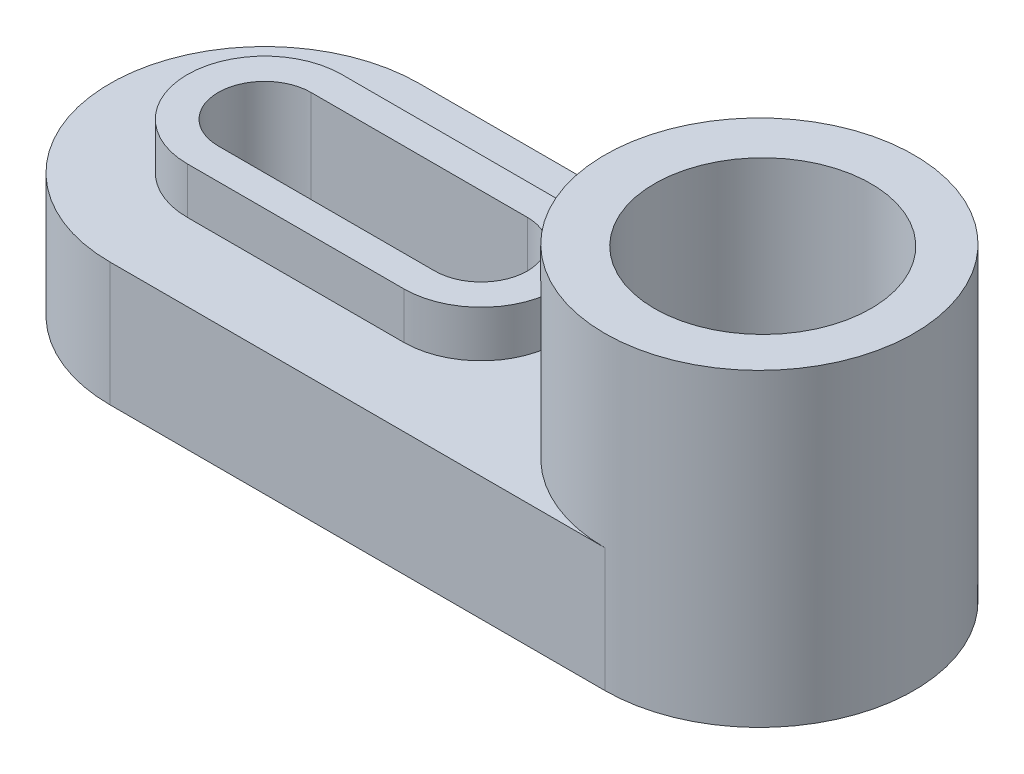
from build123d import *
from build123d.topology import SkipClean

# Parameters (mm, degrees)
EXTRUDE_1_DEPTH          = 20
EXTRUDE_2_DEPTH          = 8
EXTRUDE_3_DEPTH          = 11
CUT_EXTRUDE_7_DEPTH      = 35.292856399
CUT_EXTRUDE_7_DEPTH_BACK = 35.292856399


with BuildPart() as part:
    # 草图2 → 凸台-拉伸1 (new body)
    with BuildSketch(Plane(origin=(0, 0, 0), x_dir=(1, 0, 0), z_dir=(0, 1, 0))):
        with BuildLine():
            ThreePointArc((26, 0), (23.071067812, 7.071067812), (16, 10))
            ThreePointArc((16, 10), (6, 0), (16, -10))
            ThreePointArc((16, -10), (23.071067812, -7.071067812), (26, 0))
        make_face()
    extrude(amount=EXTRUDE_1_DEPTH)

    # 草图2<3> → 凸台-拉伸2 (add)
    with BuildSketch(Plane(origin=(0, 0, 0), x_dir=(1, 0, 0), z_dir=(0, 1, 0))):
        with BuildLine():
            Line((16, 10), (-16, 10))
            ThreePointArc((-16, 10), (-26, 0), (-16, -10))
            Line((-16, -10), (16, -10))
            ThreePointArc((16, -10), (6, 0), (16, 10))
        make_face()
    extrude(amount=EXTRUDE_2_DEPTH)

    # 草图7 → 凸台-拉伸3 (add)
    with BuildSketch(Plane(origin=(0, 0, 0), x_dir=(1, 0, 0), z_dir=(0, 1, 0))):
        with BuildLine():
            Line((-16, 5), (-2, 5))
            ThreePointArc((-2, 5), (3, 0), (-2, -5))
            Line((-2, -5), (-16, -5))
            ThreePointArc((-16, -5), (-21, 0), (-16, 5))
        make_face()
        with BuildLine():
            Line((-16, 3), (-2, 3))
            ThreePointArc((-2, 3), (1, 0), (-2, -3))
            Line((-2, -3), (-16, -3))
            ThreePointArc((-16, -3), (-19, 0), (-16, 3))
        make_face(mode=Mode.SUBTRACT)
    extrude(amount=EXTRUDE_3_DEPTH)

    # 草图7<6> → 切除-拉伸7 (cut, two sides: drawn at the far end of the back side and taken through both)
    with SkipClean():  # the faces are left unmerged after this step: merging them gives an invalid solid
        with BuildSketch(Plane(origin=(0, 0, 0), x_dir=(1, 0, 0), z_dir=(0, 1, 0)).offset(-CUT_EXTRUDE_7_DEPTH_BACK)):
            with BuildLine():
                Line((-2, 3), (-16, 3))
                ThreePointArc((-16, 3), (-19, 0), (-16, -3))
                Line((-16, -3), (-2, -3))
                ThreePointArc((-2, -3), (1, 0), (-2, 3))
            make_face()
        extrude(amount=CUT_EXTRUDE_7_DEPTH + CUT_EXTRUDE_7_DEPTH_BACK, mode=Mode.SUBTRACT)
    add(part.part.scale(1), mode=Mode.REPLACE)  # the faces are merged on a copy

    # 草图13 → Ø1.0mm 暗销孔1 (revolve, cut)
    with BuildSketch(Plane(origin=(16.218423998, 20, 0), x_dir=(0, 0, 1), z_dir=(1, 0, 0))):
        Polygon((0, 0), (0, 20), (7, 20), (7, 0), (0.525, 0), align=None)
    revolve(axis=Axis((16.218423998, 26.35, 0), (0, -1, 0)), mode=Mode.SUBTRACT)


solid = part.part
